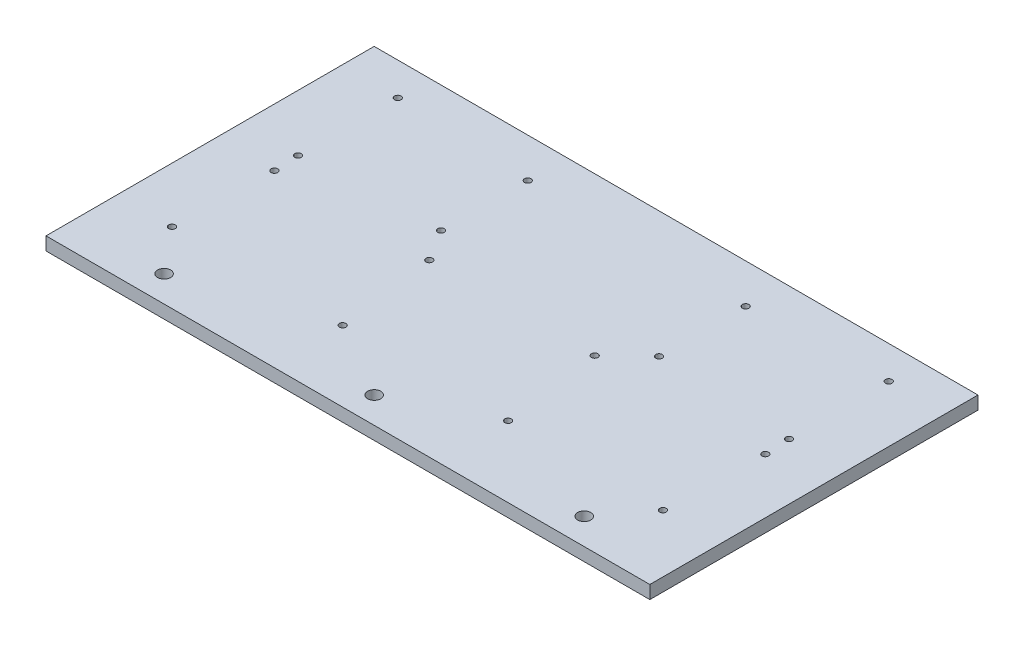
from build123d import *

# Parameters (mm, degrees)
SKETCH1_W           = 292.1
SKETCH1_H           = 158.75
BOSS_EXTRUDE1_DEPTH = 6.35
SKETCH2_R           = 3.175
CUT_EXTRUDE2_DEPTH  = 6.35
SKETCH4_R           = 1.5875
CUT_EXTRUDE3_DEPTH  = 333.512097524


with BuildPart() as part:
    # Sketch1 → Boss-Extrude1 (new body)
    with BuildSketch(Plane(origin=(0, 0, 0), x_dir=(1, 0, 0), z_dir=(0, 1, 0))):
        with Locations((146.05, 79.375)):
            Rectangle(SKETCH1_W, SKETCH1_H)
    extrude(amount=BOSS_EXTRUDE1_DEPTH)

    # Sketch2 → Cut-Extrude2 (cut)
    with BuildSketch(Plane(origin=(0, 6.35, 0), x_dir=(1, 0, 0), z_dir=(0, 1, 0))):
        with Locations((146.05, 12.7)):
            Circle(SKETCH2_R)
        with Locations((247.65, 12.7)):
            Circle(SKETCH2_R)
        with Locations((44.45, 12.7)):
            Circle(SKETCH2_R)
    extrude(amount=-CUT_EXTRUDE2_DEPTH, mode=Mode.SUBTRACT)

    # Sketch4 → Cut-Extrude3 (cut, through all)
    with BuildSketch(Plane(origin=(0, 6.35, 0), x_dir=(1, 0, 0), z_dir=(0, 1, 0))):
        with Locations((182.88, 82.55)):
            Circle(SKETCH4_R)
        with Locations((189.23, 34.29)):
            Circle(SKETCH4_R)
        with Locations((265.43, 82.55)):
            Circle(SKETCH4_R)
        with Locations((264.16, 34.29)):
            Circle(SKETCH4_R)
        with Locations((264.795, 142.875)):
            Circle(SKETCH4_R)
        with Locations((264.795, 94.615)):
            Circle(SKETCH4_R)
        with Locations((198.755, 97.79)):
            Circle(SKETCH4_R)
        with Locations((198.755, 139.7)):
            Circle(SKETCH4_R)
        with Locations((102.87, 82.55)):
            Circle(SKETCH4_R)
        with Locations((109.22, 34.29)):
            Circle(SKETCH4_R)
        with Locations((26.67, 34.29)):
            Circle(SKETCH4_R)
        with Locations((27.94, 82.55)):
            Circle(SKETCH4_R)
        with Locations((93.345, 139.7)):
            Circle(SKETCH4_R)
        with Locations((93.345, 97.79)):
            Circle(SKETCH4_R)
        with Locations((27.305, 142.875)):
            Circle(SKETCH4_R)
        with Locations((27.305, 94.615)):
            Circle(SKETCH4_R)
    extrude(amount=-CUT_EXTRUDE3_DEPTH, mode=Mode.SUBTRACT)


solid = part.part
